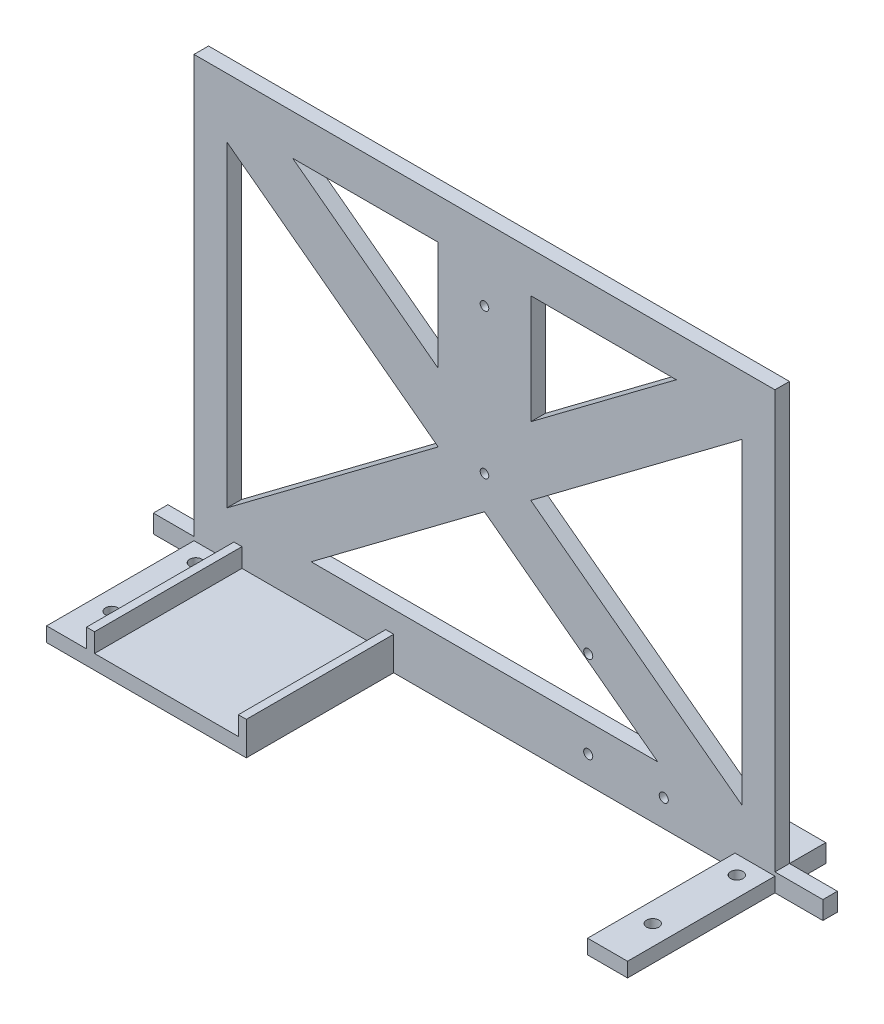
from build123d import *

# Parameters (mm, degrees)
SKETCH1_W           = 203.2
SKETCH1_H           = 152.4
SKETCH1_R           = 1.5
BOSS_EXTRUDE1_DEPTH = 5.08
SKETCH2_W           = 13.97
SKETCH2_H           = 5.08
BOSS_EXTRUDE2_DEPTH = 51.562
CUT_EXTRUDE1_REACH  = 189.707
SKETCH3_R           = 2.159
SKETCH4_W           = 12.7
SKETCH4_H           = 6.35
BOSS_EXTRUDE3_DEPTH = 12.7
SKETCH5_W           = 5.08
SKETCH5_H           = 6.35
BOSS_EXTRUDE4_DEPTH = 16.764
SKETCH6_W           = 5.08
SKETCH6_H           = 6.35
BOSS_EXTRUDE5_DEPTH = 14.224
CUT_EXTRUDE2_REACH  = 151.917
SKETCH7_R           = 1.5875


with BuildPart() as part:
    # Sketch1 → Boss-Extrude1 (new body)
    with BuildSketch(Plane.XY):
        Rectangle(SKETCH1_W, SKETCH1_H)
        Polygon((60.62822931, -57.017516701), (-60.62822931, -57.017516701), (0, -11.546344718), align=None, mode=Mode.SUBTRACT)
        Polygon((-90.128901552, -55.455159038), (-90.128901552, 55.455159038), (-16.188689502, 0), align=None, mode=Mode.SUBTRACT)
        Circle(SKETCH1_R, mode=Mode.SUBTRACT)
        Polygon((-67.093684812, 61.991246483), (-16.188689502, 61.991246483), (-16.188689502, 23.8125), align=None, mode=Mode.SUBTRACT)
        with Locations((0, 50.8)):
            Circle(SKETCH1_R, mode=Mode.SUBTRACT)
        Polygon((90.128901552, -55.455159038), (16.188689502, 0), (90.128901552, 55.455159038), align=None, mode=Mode.SUBTRACT)
        Polygon((67.093684812, 61.991246483), (16.188689502, 23.8125), (16.188689502, 61.991246483), align=None, mode=Mode.SUBTRACT)
    extrude(amount=BOSS_EXTRUDE1_DEPTH)

    # Sketch2 → Boss-Extrude2 (add)
    with BuildSketch(Plane.XY.offset(5.08)):
        Polygon((-101.6, -71.12), (-101.6, -76.2), (-31.75, -76.2), (-31.75, -64.525795504), (-34.544, -64.525795504), (-34.544, -71.12), (-84.836, -71.12), (-84.836, -64.525795504), (-87.63, -64.525795504), (-87.63, -71.12), align=None)
        with Locations((94.615, -73.66)):
            Rectangle(SKETCH2_W, SKETCH2_H)
    extrude(amount=BOSS_EXTRUDE2_DEPTH)

    # Sketch3 → Cut-Extrude1 (cut, up to next)
    with BuildSketch(Plane(origin=(0, -71.12, 0), x_dir=(1, 0, 0), z_dir=(0, 1, 0)), mode=Mode.PRIVATE) as cut_extrude1_sk1:
        with Locations((-94.615, -11.43)):
            Circle(SKETCH3_R)
    cut_extrude1_tool1 = extrude(cut_extrude1_sk1.sketch, amount=-CUT_EXTRUDE1_REACH, mode=Mode.PRIVATE) & part.part
    # Sketch3 → Cut-Extrude1 (cut, up to next)
    with BuildSketch(Plane(origin=(0, -71.12, 0), x_dir=(1, 0, 0), z_dir=(0, 1, 0)), mode=Mode.PRIVATE) as cut_extrude1_sk2:
        with Locations((94.615, -11.43)):
            Circle(SKETCH3_R)
    cut_extrude1_tool2 = extrude(cut_extrude1_sk2.sketch, amount=-CUT_EXTRUDE1_REACH, mode=Mode.PRIVATE) & part.part
    # Sketch3 → Cut-Extrude1 (cut, up to next)
    with BuildSketch(Plane(origin=(0, -71.12, 0), x_dir=(1, 0, 0), z_dir=(0, 1, 0)), mode=Mode.PRIVATE) as cut_extrude1_sk3:
        with Locations((-94.615, -40.84)):
            Circle(SKETCH3_R)
    cut_extrude1_tool3 = extrude(cut_extrude1_sk3.sketch, amount=-CUT_EXTRUDE1_REACH, mode=Mode.PRIVATE) & part.part
    # Sketch3 → Cut-Extrude1 (cut, up to next)
    with BuildSketch(Plane(origin=(0, -71.12, 0), x_dir=(1, 0, 0), z_dir=(0, 1, 0)), mode=Mode.PRIVATE) as cut_extrude1_sk4:
        with Locations((94.615, -40.84)):
            Circle(SKETCH3_R)
    cut_extrude1_tool4 = extrude(cut_extrude1_sk4.sketch, amount=-CUT_EXTRUDE1_REACH, mode=Mode.PRIVATE) & part.part
    add(cut_extrude1_tool1.solids().sort_by_distance((-94.615, -71.12, 11.43))[0], mode=Mode.SUBTRACT)
    add(cut_extrude1_tool2.solids().sort_by_distance((94.615, -71.12, 11.43))[0], mode=Mode.SUBTRACT)
    add(cut_extrude1_tool3.solids().sort_by_distance((-94.615, -71.12, 40.84))[0], mode=Mode.SUBTRACT)
    add(cut_extrude1_tool4.solids().sort_by_distance((94.615, -71.12, 40.84))[0], mode=Mode.SUBTRACT)

    # Sketch4 → Boss-Extrude3 (add)
    with BuildSketch(Plane(origin=(0, 0, 0), x_dir=(-1, 0, 0), z_dir=(0, 0, -1))):
        with Locations((-95.25, -73.025)):
            Rectangle(SKETCH4_W, SKETCH4_H)
        with Locations((95.25, -73.025)):
            Rectangle(SKETCH4_W, SKETCH4_H)
    extrude(amount=BOSS_EXTRUDE3_DEPTH)

    # Sketch5 → Boss-Extrude4 (add)
    with BuildSketch(Plane(origin=(101.6, 0, 0), x_dir=(0, 0, -1), z_dir=(1, 0, 0))):
        with Locations((-2.54, -73.025)):
            Rectangle(SKETCH5_W, SKETCH5_H)
    extrude(amount=BOSS_EXTRUDE4_DEPTH)

    # Sketch6 → Boss-Extrude5 (add)
    with BuildSketch(Plane.ZY.offset(101.6)):
        with Locations((2.54, -73.025)):
            Rectangle(SKETCH6_W, SKETCH6_H)
    extrude(amount=BOSS_EXTRUDE5_DEPTH)

    # Sketch7 → Cut-Extrude2 (cut, up to next)
    with BuildSketch(Plane.XY.offset(5.08), mode=Mode.PRIVATE) as cut_extrude2_sk1:
        with Locations((36.287585831, -66.785318729)):
            Circle(SKETCH7_R)
    cut_extrude2_tool1 = extrude(cut_extrude2_sk1.sketch, amount=-CUT_EXTRUDE2_REACH, mode=Mode.PRIVATE) & part.part
    # Sketch7 → Cut-Extrude2 (cut, up to next)
    with BuildSketch(Plane.XY.offset(5.08), mode=Mode.PRIVATE) as cut_extrude2_sk2:
        with Locations((36.287585831, -36.432318729)):
            Circle(SKETCH7_R)
    cut_extrude2_tool2 = extrude(cut_extrude2_sk2.sketch, amount=-CUT_EXTRUDE2_REACH, mode=Mode.PRIVATE) & part.part
    # Sketch7 → Cut-Extrude2 (cut, up to next)
    with BuildSketch(Plane.XY.offset(5.08), mode=Mode.PRIVATE) as cut_extrude2_sk3:
        with Locations((62.703585831, -66.785318729)):
            Circle(SKETCH7_R)
    cut_extrude2_tool3 = extrude(cut_extrude2_sk3.sketch, amount=-CUT_EXTRUDE2_REACH, mode=Mode.PRIVATE) & part.part
    add(cut_extrude2_tool1.solids().sort_by_distance((36.287586, -66.785319, 5.08))[0], mode=Mode.SUBTRACT)
    add(cut_extrude2_tool2.solids().sort_by_distance((36.287586, -36.432319, 5.08))[0], mode=Mode.SUBTRACT)
    add(cut_extrude2_tool3.solids().sort_by_distance((62.703586, -66.785319, 5.08))[0], mode=Mode.SUBTRACT)


solid = part.part
